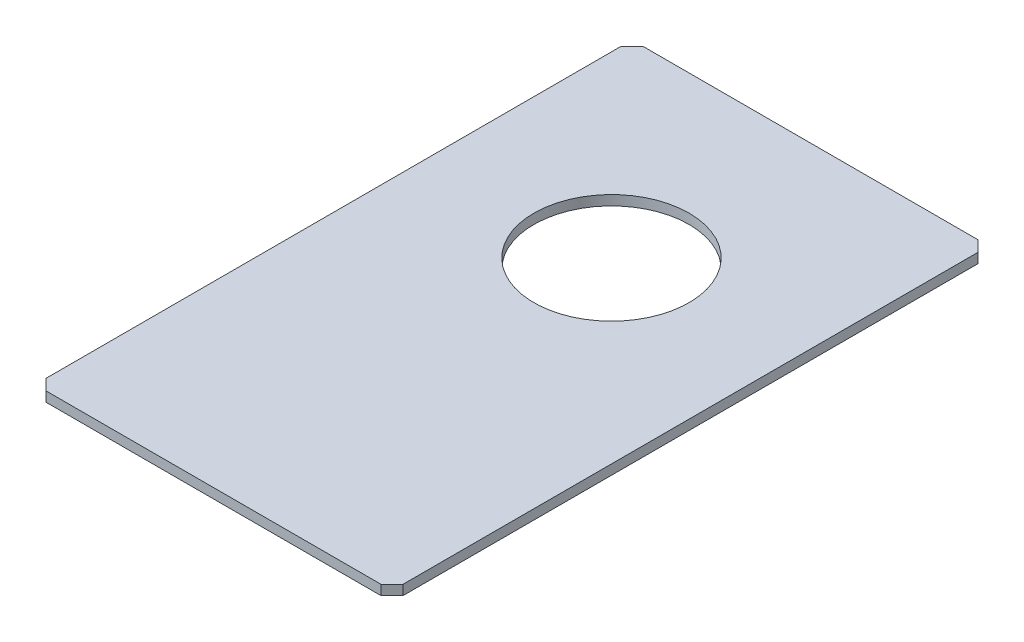
from build123d import *

# Parameters (mm, degrees)
SKETCH1_W           = 115
SKETCH1_H           = 192.3454
BOSS_EXTRUDE1_DEPTH = 3.175
CHAMFER1_SIZE       = 3.5
SKETCH2_R           = 25
CUT_EXTRUDE1_DEPTH  = 113.096025132


with BuildPart() as part:
    # Sketch1 → Boss-Extrude1 (new body)
    with BuildSketch(Plane(origin=(0, 0, 0), x_dir=(1, 0, 0), z_dir=(0, 1, 0))):
        Rectangle(SKETCH1_W, SKETCH1_H)
    extrude(amount=BOSS_EXTRUDE1_DEPTH)

    # Chamfer1
    chamfer1_edges = [part.edges().sort_by_distance(p)[0] for p in [
        (57.5, 1.5875, -96.1727),
        (-57.5, 1.5875, -96.1727),
        (-57.5, 1.5875, 96.1727),
        (57.5, 1.5875, 96.1727),
    ]]
    chamfer(chamfer1_edges, length=CHAMFER1_SIZE)

    # Sketch2 → Cut-Extrude1 (cut, through all)
    with BuildSketch(Plane.XZ):
        with Locations((0, -32.057566667)):
            Circle(SKETCH2_R)
    extrude(amount=-CUT_EXTRUDE1_DEPTH, mode=Mode.SUBTRACT)


solid = part.part
